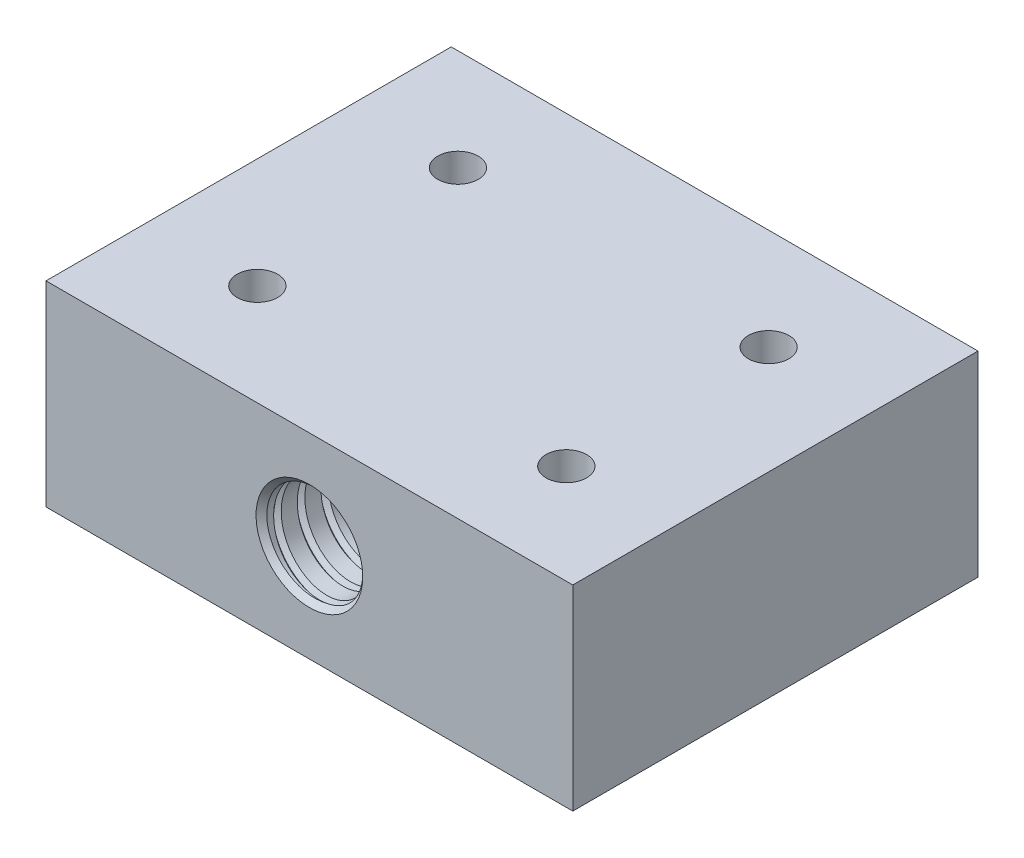
from build123d import *

# Parameters (mm, degrees)
SKETCH2_W           = 78
SKETCH2_H           = 60
BOSS_EXTRUDE2_DEPTH = 29
SKETCH4_R           = 7.1
CUT_EXTRUDE1_DEPTH  = 78.21398837
CHAMFER1_SIZE       = 0.8
SKETCH8_R           = 3
CUT_EXTRUDE2_DEPTH  = 20
THREAD1_PITCH       = 3.5


with BuildPart() as part:
    # Sketch2 → Boss-Extrude2 (new body)
    with BuildSketch(Plane(origin=(0, 0, 0), x_dir=(1, 0, 0), z_dir=(0, 1, 0))):
        Rectangle(SKETCH2_W, SKETCH2_H)
    extrude(amount=BOSS_EXTRUDE2_DEPTH)

    # Sketch4 → Cut-Extrude1 (cut, through all)
    with BuildSketch(Plane.XY.offset(30)):
        with Locations((0, 14.5)):
            Circle(SKETCH4_R)
    extrude(amount=-CUT_EXTRUDE1_DEPTH, mode=Mode.SUBTRACT)

    # Chamfer1
    chamfer1_edges = [part.edges().sort_by_distance(p)[0] for p in [
        (-7.1, 14.5, -30),
        (-7.1, 14.5, 30),
    ]]
    chamfer(chamfer1_edges, length=CHAMFER1_SIZE)

    # Sketch8 → Cut-Extrude2 (cut)
    with BuildSketch(Plane(origin=(0, 29, 0), x_dir=(1, 0, 0), z_dir=(0, 1, 0))):
        with Locations(Location((-23, 15, 0), (0, 0, 270))):
            Circle(SKETCH8_R)
        with Locations(Location((23, 15, 0), (0, 0, 270))):
            Circle(SKETCH8_R)
        with Locations(Location((23.292350502, -15.249805847, 0), (0, 0, 270))):
            Circle(SKETCH8_R)
        with Locations(Location((-22.707649498, -15, 0), (0, 0, 270))):
            Circle(SKETCH8_R)
    extrude(amount=-CUT_EXTRUDE2_DEPTH, mode=Mode.SUBTRACT)

    # Thread1: the profile of Thread Profile2 profile screwed along a right-hand helix of 18.342857 turns, 12 arcs to a turn; built about Z, then put on its axis
    thread1_z = Axis((0, 0, 0), (0, 0, 1))
    thread1_corners = [(7.0997, 0, -0.000173205), (7.911898813, 0, 0.468749998), (7.911898813, 0, 0.656249998), (7.0997, 0, 1.125173201)]
    with BuildLine(mode=Mode.PRIVATE) as thread1_profile:
        Line(thread1_corners[0], thread1_corners[1])
        Line(thread1_corners[1], thread1_corners[2])
        Line(thread1_corners[2], thread1_corners[3])
        Line(thread1_corners[3], thread1_corners[0])
    thread1_cap = Face(thread1_profile.wire())
    thread1_turn_angles = [0, 15, 30, 45, 60, 75, 90, 105, 120, 135, 150, 165, 180, 195, 210, 225, 240, 255, 270, 285, 300, 315, 330, 345, 360]
    thread1_turn_weights = [1, 0.9659258262890683, 1, 0.9659258262890683, 1, 0.9659258262890683, 1, 0.9659258262890683, 1, 0.9659258262890683, 1, 0.9659258262890683, 1, 0.9659258262890683, 1, 0.9659258262890683, 1, 0.9659258262890683, 1, 0.9659258262890683, 1, 0.9659258262890683, 1, 0.9659258262890683, 1]
    thread1_turn_rails = [Edge.make_bspline([Vector(p[0], p[1], 0).rotate(thread1_z, thread1_turn_angles[k]) / thread1_turn_weights[k] + Vector(0, 0, p[2] + THREAD1_PITCH * thread1_turn_angles[k] / 360) for k in range(25)], [0, 0, 0, 1, 1, 2, 2, 3, 3, 4, 4, 5, 5, 6, 6, 7, 7, 8, 8, 9, 9, 10, 10, 11, 11, 12, 12, 12], 2, thread1_turn_weights) for p in thread1_corners]
    thread1_turn_sides = [Face.make_surface_from_curves(thread1_turn_rails[p[0]], thread1_turn_rails[p[1]]) for p in [(0, 1), (1, 2), (2, 3), (3, 0)]]
    thread1_last_angles = [6480, 6495, 6510, 6525, 6540, 6555, 6570, 6585, 6600, 6601.714285714, 6603.428571429]
    thread1_last_weights = [1, 0.9659258262890683, 1, 0.9659258262890683, 1, 0.9659258262890683, 1, 0.9659258262890683, 1, 0.9995524322835035, 1]
    thread1_last_rails = [Edge.make_bspline([Vector(p[0], p[1], 0).rotate(thread1_z, thread1_last_angles[k]) / thread1_last_weights[k] + Vector(0, 0, p[2] + THREAD1_PITCH * thread1_last_angles[k] / 360) for k in range(11)], [0, 0, 0, 1, 1, 2, 2, 3, 3, 4, 4, 5, 5, 5], 2, thread1_last_weights) for p in thread1_corners]
    thread1_last_sides = [Face.make_surface_from_curves(thread1_last_rails[p[0]], thread1_last_rails[p[1]]) for p in [(0, 1), (1, 2), (2, 3), (3, 0)]]
    thread1 = Plane(origin=(0, 14.5, -34.2), x_dir=(1, 0, 0), z_dir=(0, 0, 1)) * Solid(Shell([*[p.moved(Location((0, 0, THREAD1_PITCH * i))) for i in range(18) for p in thread1_turn_sides], *thread1_last_sides, thread1_cap, thread1_cap.rotate(thread1_z, 6603.428571429).moved(Location((0, 0, THREAD1_PITCH * 6603.428571429 / 360)))]))
    add(thread1, mode=Mode.SUBTRACT)


solid = part.part
